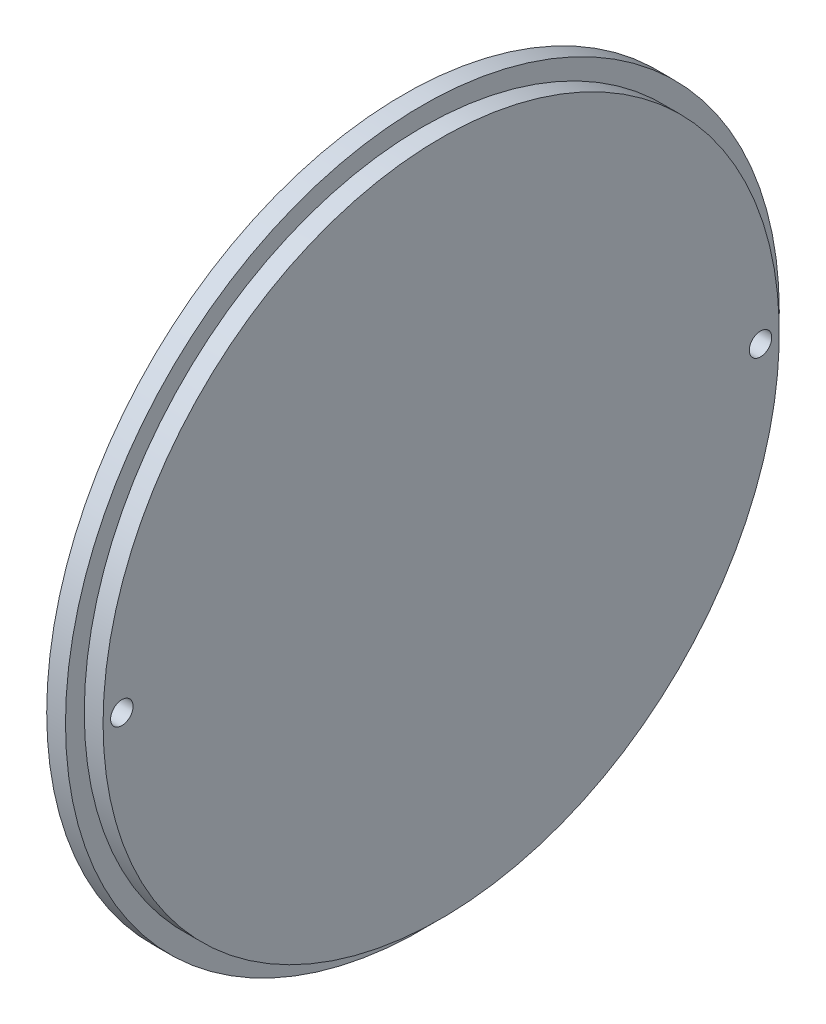
from build123d import *

# Parameters (mm, degrees)
SKETCH1_R              = 60.325
BOSS_EXTRUDE1_DEPTH    = 3.175
SKETCH2_R              = 57.15
BOSS_EXTRUDE2_DEPTH    = 6.35
F_10_24_TAPPED_HOLE1_D = 3.7973


with BuildPart() as part:
    # Sketch1 → Boss-Extrude1 (new body)
    with BuildSketch(Plane(origin=(0, 0, 0), x_dir=(0, 0, -1), z_dir=(1, 0, 0))):
        Circle(SKETCH1_R)
    extrude(amount=BOSS_EXTRUDE1_DEPTH)

    # Sketch2 → Boss-Extrude2 (add)
    with BuildSketch(Plane.ZY):
        Circle(SKETCH2_R)
    extrude(amount=-BOSS_EXTRUDE2_DEPTH)

    # #10-24 Tapped Hole1 (through all)
    with Locations(Plane.ZY):
        with Locations((-53.975, 0), (53.975, 0)):
            Hole(F_10_24_TAPPED_HOLE1_D / 2)


solid = part.part
